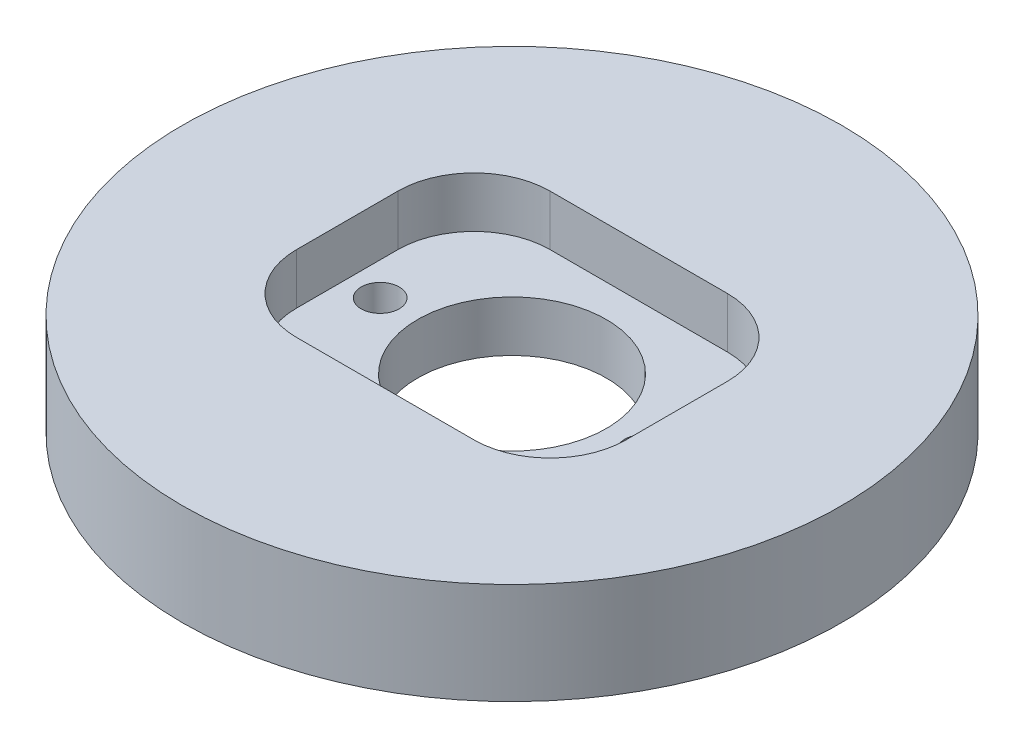
from build123d import *

# Parameters (mm, degrees)
SKETCH2_R           = 13
BOSS_EXTRUDE1_DEPTH = 4
SKETCH3_W           = 13
SKETCH3_H           = 10
CUT_EXTRUDE1_DEPTH  = 2
FILLET1_R           = 3
SKETCH4_R           = 3.725
SKETCH4_R_2         = 0.75
CUT_EXTRUDE2_DEPTH  = 19.493242009


with BuildPart() as part:
    # Sketch2 → Boss-Extrude1 (new body)
    with BuildSketch(Plane(origin=(0, 0, 0), x_dir=(1, 0, 0), z_dir=(0, 1, 0))):
        Circle(SKETCH2_R)
    extrude(amount=BOSS_EXTRUDE1_DEPTH)

    # Sketch3 → Cut-Extrude1 (cut)
    with BuildSketch(Plane(origin=(0, 4, 0), x_dir=(1, 0, 0), z_dir=(0, 1, 0))):
        Rectangle(SKETCH3_W, SKETCH3_H)
    extrude(amount=-CUT_EXTRUDE1_DEPTH, mode=Mode.SUBTRACT)

    # Fillet1
    fillet1_edges = [part.edges().sort_by_distance(p)[0] for p in [
        (-6.5, 3, 5),
        (6.5, 3, 5),
        (-6.5, 3, -5),
        (6.5, 3, -5),
    ]]
    fillet(fillet1_edges, radius=FILLET1_R)

    # Sketch4 → Cut-Extrude2 (cut, through all)
    with BuildSketch(Plane(origin=(0, 2, 0), x_dir=(1, 0, 0), z_dir=(0, 1, 0))):
        Circle(SKETCH4_R)
        with Locations((-5.2, 0)):
            Circle(SKETCH4_R_2)
        with Locations((5.2, 0)):
            Circle(SKETCH4_R_2)
    extrude(amount=-CUT_EXTRUDE2_DEPTH, mode=Mode.SUBTRACT)


solid = part.part
